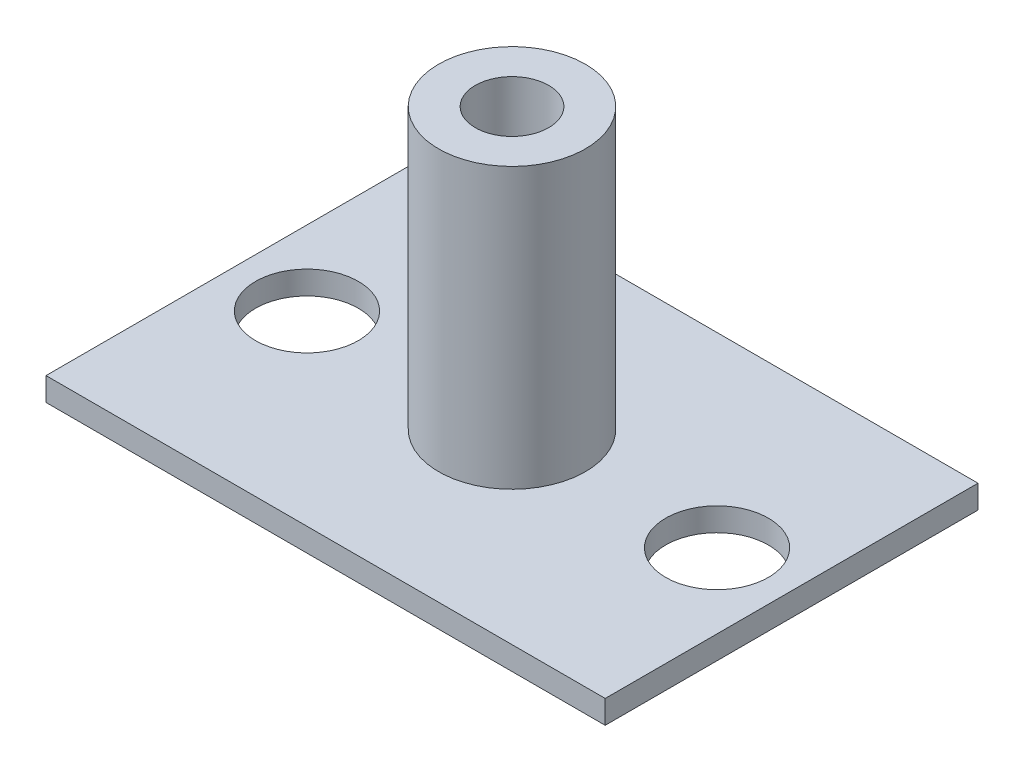
from build123d import *

# Parameters (mm, degrees)
SKETCH1_W           = 38.1
SKETCH1_H           = 25.4
BOSS_EXTRUDE1_DEPTH = 1.5875
SKETCH3_R           = 5
SKETCH3_R_2         = 2.5
BOSS_EXTRUDE2_DEPTH = 19.05
SKETCH4_R           = 3.5
CUT_EXTRUDE1_DEPTH  = 35.525178946


with BuildPart() as part:
    # Sketch1 → Boss-Extrude1 (new body)
    with BuildSketch(Plane(origin=(0, 0, 0), x_dir=(1, 0, 0), z_dir=(0, 1, 0))):
        with Locations((-6.79173913, 0)):
            Rectangle(SKETCH1_W, SKETCH1_H)
    extrude(amount=BOSS_EXTRUDE1_DEPTH)

    # Sketch3 → Boss-Extrude2 (add)
    with BuildSketch(Plane(origin=(0, 1.5875, 0), x_dir=(1, 0, 0), z_dir=(0, 1, 0))):
        with Locations((-6.79173913, 0)):
            Circle(SKETCH3_R)
        with Locations((-6.79173913, 0)):
            Circle(SKETCH3_R_2, mode=Mode.SUBTRACT)
    extrude(amount=BOSS_EXTRUDE2_DEPTH)

    # Sketch4 → Cut-Extrude1 (cut, through all)
    with BuildSketch(Plane(origin=(0, 1.5875, 0), x_dir=(1, 0, 0), z_dir=(0, 1, 0))):
        with Locations((7.17826087, 0)):
            Circle(SKETCH4_R)
        with Locations((-20.76173913, 0)):
            Circle(SKETCH4_R)
    extrude(amount=-CUT_EXTRUDE1_DEPTH, mode=Mode.SUBTRACT)


solid = part.part
